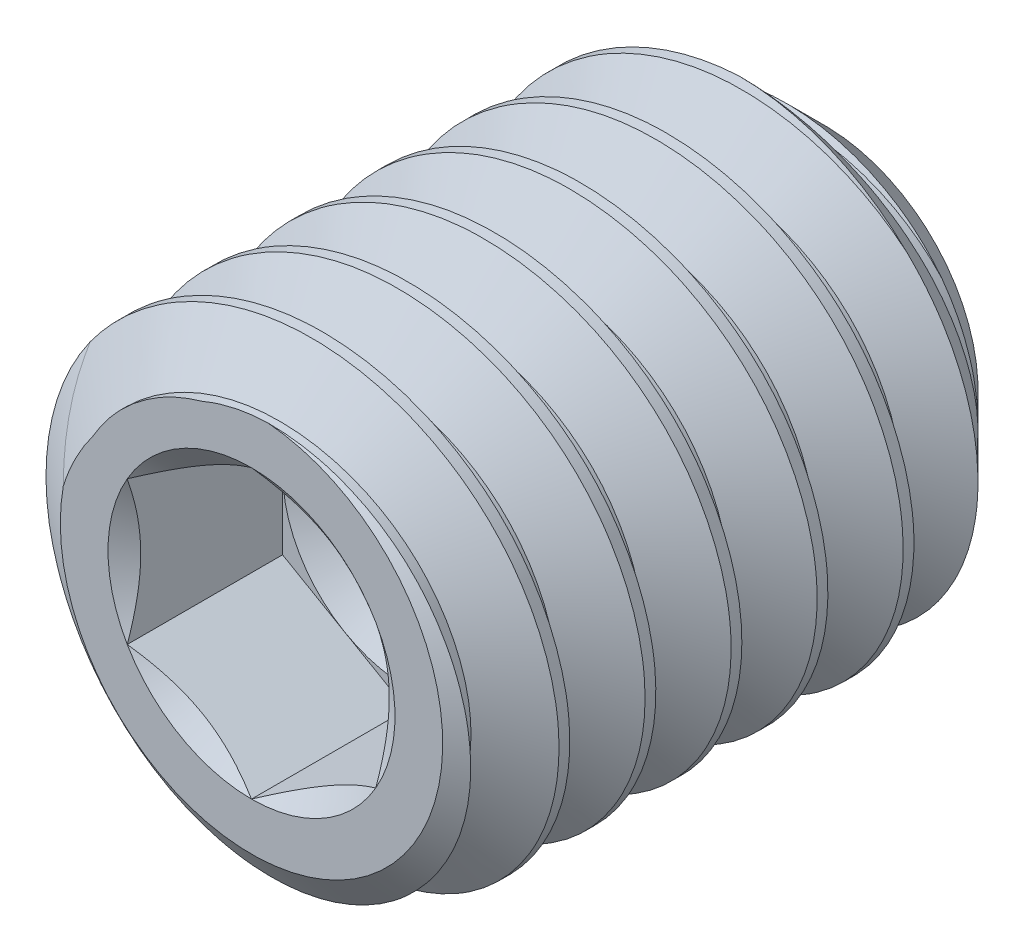
from build123d import *

# Parameters (mm, degrees)
CUT_EXTRUDE10_DEPTH = 0.8125
CUT_SWEEP2_PITCH    = 0.45


with BuildPart() as part:
    # Sketch22 → Revolve1 (revolve)
    with BuildSketch(Plane(origin=(0, 0, 0), x_dir=(0, 0, -1), z_dir=(1, 0, 0)), mode=Mode.PRIVATE) as revolve1_sk:
        Polygon((-1.5, 0), (-1.5, 1), (-1.324948115, 1.25), (1.05, 1.25), (1.5, 0.8), (1.5, 0), align=None)
    revolve(revolve1_sk.sketch.rotate(Axis((0, 0, -1.5), (0, 0, 1)), 90), axis=Axis((0, 0, -1.5), (0, 0, 1)))

    # Sketch23 → Cut-Extrude10 (cut)
    with BuildSketch(Plane.XY.offset(1.5)):
        Polygon((0, 0.75055535), (-0.65, 0.375277675), (-0.65, -0.375277675), (0, -0.75055535), (0.65, -0.375277675), (0.65, 0.375277675), align=None)
    extrude(amount=-CUT_EXTRUDE10_DEPTH, mode=Mode.SUBTRACT)

    # Cut-Extrude11 cone 1 section (through the dimple's axis) → Cut-Extrude11 (revolve, cut)
    with BuildSketch(Plane(origin=(0, 0, 1.5), x_dir=(0, -1, 0), z_dir=(1, 0, 0))):
        Polygon((0, 0), (0.75055535, 0), (0, 0.525544514), align=None)
    revolve(axis=Axis((0, 0, 1.5), (0, 0, -1)), mode=Mode.SUBTRACT)

    # Cut-Extrude12 cone 1 section (through the dimple's axis) → Cut-Extrude12 (revolve, cut)
    with BuildSketch(Plane(origin=(0, 0, 0.6875), x_dir=(0, -1, 0), z_dir=(1, 0, 0))):
        Polygon((0, 0), (0.65, 0), (0, 0.375277675), align=None)
    revolve(axis=Axis((0, 0, 0.6875), (0, 0, -1)), mode=Mode.SUBTRACT)

    # Cut-Sweep2: the profile of Sketch28 profile screwed along a right-hand helix of 7.666667 turns, 6 arcs to a turn; built about Z, then put on its axis
    cut_sweep2_z = Axis((0, 0, 0), (0, 0, 1))
    cut_sweep2_corners = [(1.2503, 0, 0.000173205), (1.2503, 0, -0.393923205), (0.957716426, 0, -0.225), (0.957716426, 0, -0.16875)]
    with BuildLine(mode=Mode.PRIVATE) as cut_sweep2_profile:
        Line(cut_sweep2_corners[0], cut_sweep2_corners[1])
        Line(cut_sweep2_corners[1], cut_sweep2_corners[2])
        Line(cut_sweep2_corners[2], cut_sweep2_corners[3])
        Line(cut_sweep2_corners[3], cut_sweep2_corners[0])
    cut_sweep2_cap = Face(cut_sweep2_profile.wire())
    cut_sweep2_turn_angles = [0, 30, 60, 90, 120, 150, 180, 210, 240, 270, 300, 330, 360]
    cut_sweep2_turn_weights = [1, 0.8660254037844387, 1, 0.8660254037844387, 1, 0.8660254037844387, 1, 0.8660254037844387, 1, 0.8660254037844387, 1, 0.8660254037844387, 1]
    cut_sweep2_turn_rails = [Edge.make_bspline([Vector(p[0], p[1], 0).rotate(cut_sweep2_z, cut_sweep2_turn_angles[k]) / cut_sweep2_turn_weights[k] + Vector(0, 0, p[2] + CUT_SWEEP2_PITCH * cut_sweep2_turn_angles[k] / 360) for k in range(13)], [0, 0, 0, 1, 1, 2, 2, 3, 3, 4, 4, 5, 5, 6, 6, 6], 2, cut_sweep2_turn_weights) for p in cut_sweep2_corners]
    cut_sweep2_turn_sides = [Face.make_surface_from_curves(cut_sweep2_turn_rails[p[0]], cut_sweep2_turn_rails[p[1]]) for p in [(0, 1), (1, 2), (2, 3), (3, 0)]]
    cut_sweep2_last_angles = [2520, 2550, 2580, 2610, 2640, 2670, 2700, 2730, 2760]
    cut_sweep2_last_weights = [1, 0.8660254037844387, 1, 0.8660254037844387, 1, 0.8660254037844387, 1, 0.8660254037844148, 1]
    cut_sweep2_last_rails = [Edge.make_bspline([Vector(p[0], p[1], 0).rotate(cut_sweep2_z, cut_sweep2_last_angles[k]) / cut_sweep2_last_weights[k] + Vector(0, 0, p[2] + CUT_SWEEP2_PITCH * cut_sweep2_last_angles[k] / 360) for k in range(9)], [0, 0, 0, 1, 1, 2, 2, 3, 3, 4, 4, 4], 2, cut_sweep2_last_weights) for p in cut_sweep2_corners]
    cut_sweep2_last_sides = [Face.make_surface_from_curves(cut_sweep2_last_rails[p[0]], cut_sweep2_last_rails[p[1]]) for p in [(0, 1), (1, 2), (2, 3), (3, 0)]]
    cut_sweep2 = Plane(origin=(0, 0, -1.5), x_dir=(0, 1, 0), z_dir=(0, 0, 1)) * Solid(Shell([*[p.moved(Location((0, 0, CUT_SWEEP2_PITCH * i))) for i in range(7) for p in cut_sweep2_turn_sides], *cut_sweep2_last_sides, cut_sweep2_cap, cut_sweep2_cap.rotate(cut_sweep2_z, 2760).moved(Location((0, 0, CUT_SWEEP2_PITCH * 2760 / 360)))]))
    add(cut_sweep2, mode=Mode.SUBTRACT)


solid = part.part
